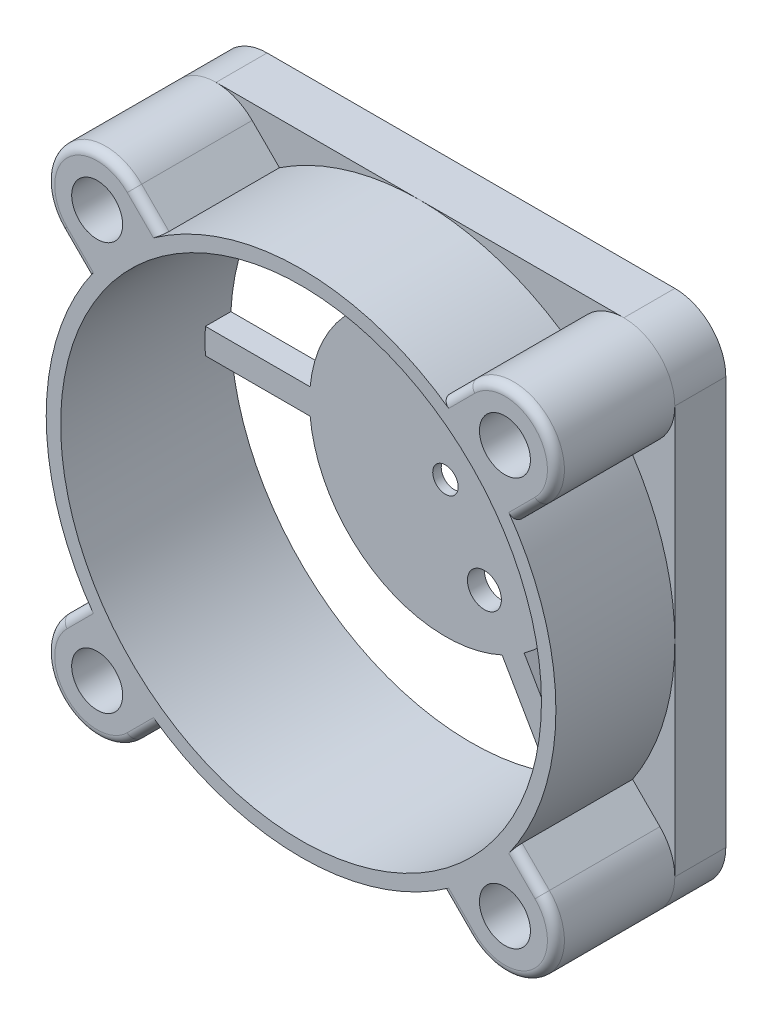
from build123d import *

# Parameters (mm, degrees)
SKETCH1_W           = 30
SKETCH1_H           = 30
BOSS_EXTRUDE1_DEPTH = 3
SKETCH2_R           = 15
BOSS_EXTRUDE2_DEPTH = 7
BOSS_EXTRUDE3_DEPTH = 7
FILLET1_R           = 3
SKETCH5_R           = 14.15
CUT_EXTRUDE2_DEPTH  = 10
SKETCH6_R           = 1.5
CUT_EXTRUDE3_DEPTH  = 10
SKETCH7_R           = 8
BOSS_EXTRUDE4_DEPTH = 1.5
SKETCH8_W           = 13.15764426
SKETCH8_H           = 1.5
BOSS_EXTRUDE5_DEPTH = 1.5
SKETCH9_R           = 0.75
CUT_EXTRUDE4_DEPTH  = 1.5
SKETCH10_R          = 2
CUT_EXTRUDE5_DEPTH  = 1
SKETCH11_R          = 6.75
CUT_EXTRUDE6_DEPTH  = 0.5
SKETCH12_W          = 3.4
SKETCH12_H          = 2.5
CUT_EXTRUDE7_DEPTH  = 0.5
CUT_EXTRUDE8_DEPTH  = 0.5
SKETCH14_R          = 1
CUT_EXTRUDE9_DEPTH  = 2
FILLET2_R           = 0.5


with BuildPart() as part:
    # Sketch1 → Boss-Extrude1 (new body)
    with BuildSketch(Plane.XY):
        Rectangle(SKETCH1_W, SKETCH1_H)
    extrude(amount=BOSS_EXTRUDE1_DEPTH)

    # Sketch2 → Boss-Extrude2 (add)
    with BuildSketch(Plane.XY.offset(3)):
        Circle(SKETCH2_R)
    extrude(amount=BOSS_EXTRUDE2_DEPTH)

    # Sketch4 → Boss-Extrude3 (add)
    with BuildSketch(Plane.XY.offset(3)):
        with BuildLine():
            Line((-14.121320344, 9.878679656), (-4.242640687, 0))
            Line((-4.242640687, 0), (-14.121320344, -9.878679656))
            ThreePointArc((-14.121320344, -9.878679656), (-14.121320344, -14.121320344), (-9.878679656, -14.121320344))
            Line((-9.878679656, -14.121320344), (0, -4.242640687))
            Line((0, -4.242640687), (9.878679656, -14.121320344))
            ThreePointArc((9.878679656, -14.121320344), (14.121320344, -14.121320344), (14.121320344, -9.878679656))
            Line((14.121320344, -9.878679656), (4.242640687, 0))
            Line((4.242640687, 0), (14.121320344, 9.878679656))
            ThreePointArc((14.121320344, 9.878679656), (14.121320344, 14.121320344), (9.878679656, 14.121320344))
            Line((9.878679656, 14.121320344), (0, 4.242640687))
            Line((0, 4.242640687), (-9.878679656, 14.121320344))
            ThreePointArc((-9.878679656, 14.121320344), (-14.121320344, 14.121320344), (-14.121320344, 9.878679656))
        make_face()
    extrude(amount=BOSS_EXTRUDE3_DEPTH)

    # Fillet1
    fillet1_edges = [part.edges().sort_by_distance(p)[0] for p in [
        (-15, -15, 1.5),
        (15, -15, 1.5),
        (15, 15, 1.5),
        (-15, 15, 1.5),
    ]]
    fillet(fillet1_edges, radius=FILLET1_R - 0.0001)  # a hair under: the kernel refuses the full size

    # Sketch5 → Cut-Extrude2 (cut)
    with BuildSketch(Plane.XY.offset(10)):
        Circle(SKETCH5_R)
    extrude(amount=-CUT_EXTRUDE2_DEPTH, mode=Mode.SUBTRACT)

    # Sketch6 → Cut-Extrude3 (cut)
    with BuildSketch(Plane.XY.offset(10)):
        with Locations((-12, 12)):
            Circle(SKETCH6_R)
        with Locations((12, 12)):
            Circle(SKETCH6_R)
        with Locations((12, -12)):
            Circle(SKETCH6_R)
        with Locations((-12, -12)):
            Circle(SKETCH6_R)
    extrude(amount=-CUT_EXTRUDE3_DEPTH, mode=Mode.SUBTRACT)



with BuildPart() as body_2:
    # Sketch7 → Boss-Extrude4 (new body)
    with BuildSketch(Plane(origin=(0, 0, 0), x_dir=(-1, 0, 0), z_dir=(0, 0, -1))):
        Circle(SKETCH7_R)
    extrude(amount=-BOSS_EXTRUDE4_DEPTH)


with BuildPart() as part_1:
    add(part.part)

    add(body_2.part)  # Boss-Extrude5 merges body 2
    # Sketch8 → Boss-Extrude5 (add)
    with BuildSketch(Plane(origin=(0, 0, 0), x_dir=(-1, 0, 0), z_dir=(0, 0, -1))):
        Polygon((-0.061069882, -1.605776139), (-6.639892012, -13.000630322), (-7.938930118, -12.250630322), (-1.360107988, -0.855776139), align=None)
        with Locations((8, 0)):
            Rectangle(SKETCH8_W, SKETCH8_H)
        Polygon((-1.360107988, 0.855776139), (-7.938930118, 12.250630322), (-6.639892012, 13.000630322), (-0.061069882, 1.605776139), align=None)
    extrude(amount=-BOSS_EXTRUDE5_DEPTH)

    # Sketch9 → Cut-Extrude4 (cut)
    with BuildSketch(Plane(origin=(0, 0, 0), x_dir=(-1, 0, 0), z_dir=(0, 0, -1))):
        Circle(SKETCH9_R)
    extrude(amount=-CUT_EXTRUDE4_DEPTH, mode=Mode.SUBTRACT)

    # Sketch10 → Cut-Extrude5 (cut)
    with BuildSketch(Plane(origin=(0, 0, 0), x_dir=(-1, 0, 0), z_dir=(0, 0, -1))):
        Circle(SKETCH10_R)
    extrude(amount=-CUT_EXTRUDE5_DEPTH, mode=Mode.SUBTRACT)

    # Sketch11 → Cut-Extrude6 (cut)
    with BuildSketch(Plane(origin=(0, 0, 0), x_dir=(-1, 0, 0), z_dir=(0, 0, -1))):
        Circle(SKETCH11_R)
    extrude(amount=-CUT_EXTRUDE6_DEPTH, mode=Mode.SUBTRACT)

    # Sketch12 → Cut-Extrude7 (cut)
    with BuildSketch(Plane(origin=(0, 0, 0), x_dir=(-1, 0, 0), z_dir=(0, 0, -1))):
        with Locations((-8.1, -14.251318629)):
            Rectangle(SKETCH12_W, SKETCH12_H)
    extrude(amount=-CUT_EXTRUDE7_DEPTH, mode=Mode.SUBTRACT)

    # Sketch13 → Cut-Extrude8 (cut)
    with BuildSketch(Plane(origin=(0, 0, 0), x_dir=(-1, 0, 0), z_dir=(0, 0, -1))):
        Polygon((-1.799060557, -4.71606429), (-6.993041412, -13.712303025), (-7.685861735, -13.312303025), (-2.49188088, -4.31606429), align=None)
    extrude(amount=-CUT_EXTRUDE8_DEPTH, mode=Mode.SUBTRACT)

    # Sketch14 → Cut-Extrude9 (cut)
    with BuildSketch(Plane(origin=(0, 0, 0.5), x_dir=(-1, 0, 0), z_dir=(0, 0, -1))):
        with Locations((-2.291903498, -4.48287736)):
            Circle(SKETCH14_R)
    extrude(amount=-CUT_EXTRUDE9_DEPTH, mode=Mode.SUBTRACT)

    # Fillet2
    fillet2_edges = [part_1.edges().sort_by_distance(p)[0] for p in [
        (13.317472766, 9.074832079, 10),
        (14.121320344, 14.121320344, 10),
        (9.074832079, 13.317472766, 10),
        (-9.074832079, 13.317472766, 10),
        (-14.121320344, 14.121320344, 10),
        (-13.317472766, 9.074832079, 10),
        (-13.317472766, -9.074832079, 10),
        (-14.121320344, -14.121320344, 10),
        (-9.074832079, -13.317472766, 10),
        (9.074832079, -13.317472766, 10),
        (14.121320344, -14.121320344, 10),
        (13.317472766, -9.074832079, 10),
    ]]
    fillet(fillet2_edges, radius=FILLET2_R)


solid = part_1.part
